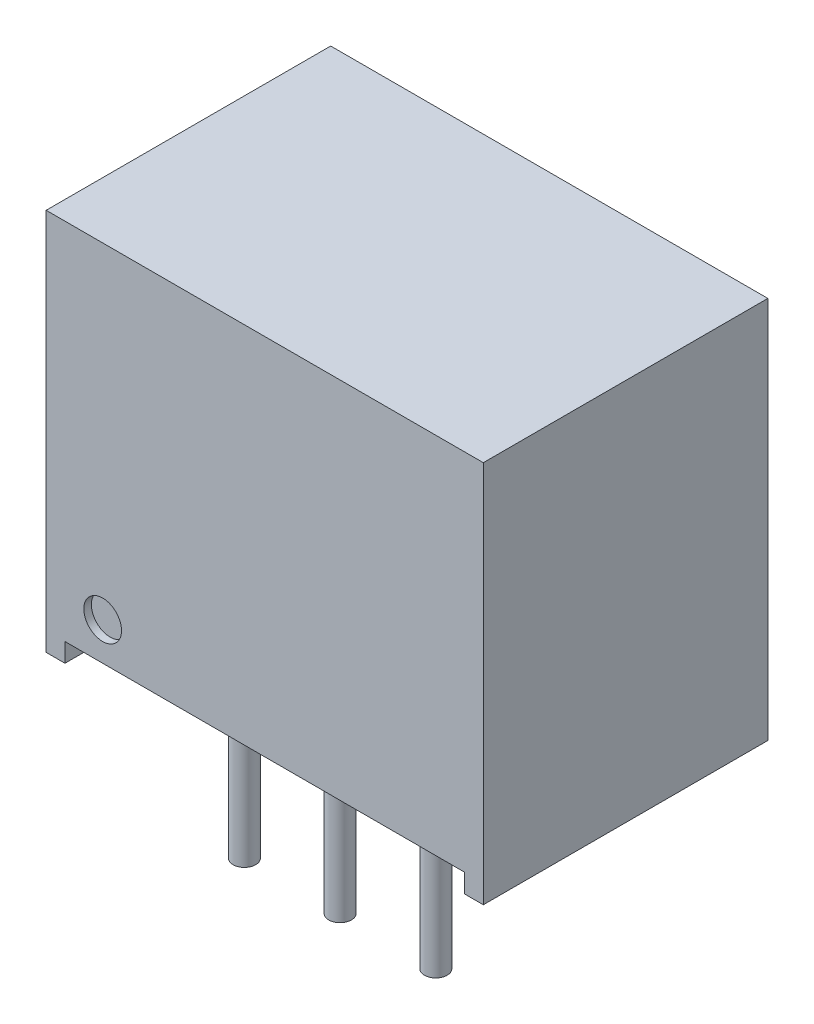
from build123d import *

# Parameters (mm, degrees)
SKETCH1_W                   = 11.6
SKETCH1_H                   = 7.55
BOSS_EXTRUDE1_DEPTH         = 10.16
SKETCH2_R                   = 0.5
CUT_EXTRUDE1_DEPTH          = 0.2
SKETCH3_R                   = 0.3
BOSS_EXTRUDE3_DEPTH         = 4.1
CUT_EXTRUDE_THIN1_START     = -0.5
CUT_EXTRUDE_THIN1_OUTLINE_W = 10.6
CUT_EXTRUDE_THIN1_OUTLINE_H = 7.55
CUT_EXTRUDE_THIN1_OUTLINE_R = 0.3
CUT_EXTRUDE_THIN1_DEPTH     = 0.5


# Read off the part's stored shape, not the designer's step: Cut-Extrude-Thin1
with BuildPart() as part:
    # Sketch1 → Boss-Extrude1 (new body)
    with BuildSketch(Plane(origin=(0, 0, 0), x_dir=(1, 0, 0), z_dir=(0, 1, 0))):
        with Locations((5.8, 3.775)):
            Rectangle(SKETCH1_W, SKETCH1_H)
    extrude(amount=BOSS_EXTRUDE1_DEPTH)

    # Sketch2 → Cut-Extrude1 (cut)
    with BuildSketch(Plane.XY):
        with Locations((1.5, 1.5)):
            Circle(SKETCH2_R)
    extrude(amount=-CUT_EXTRUDE1_DEPTH, mode=Mode.SUBTRACT)

    # Sketch3 → Boss-Extrude3 (add)
    with BuildSketch(Plane.XZ):
        with Locations(Location((5.8, -2, 0), (0, 0, 270))):
            Circle(SKETCH3_R)
        with Locations(Location((8.34, -2, 0), (0, 0, 270))):
            Circle(SKETCH3_R)
        with Locations(Location((3.26, -2, 0), (0, 0, 270))):
            Circle(SKETCH3_R)
    extrude(amount=BOSS_EXTRUDE3_DEPTH)

    # Cut-Extrude-Thin1 outline → Cut-Extrude-Thin1 (cut)
    with BuildSketch(Plane.XZ.offset(CUT_EXTRUDE_THIN1_START)):
        with Locations((5.8, -3.775)):
            Rectangle(CUT_EXTRUDE_THIN1_OUTLINE_W, CUT_EXTRUDE_THIN1_OUTLINE_H)
        with Locations((3.26, -2)):
            Circle(CUT_EXTRUDE_THIN1_OUTLINE_R, mode=Mode.SUBTRACT)
        with Locations((5.8, -2)):
            Circle(CUT_EXTRUDE_THIN1_OUTLINE_R, mode=Mode.SUBTRACT)
        with Locations((8.34, -2)):
            Circle(CUT_EXTRUDE_THIN1_OUTLINE_R, mode=Mode.SUBTRACT)
    extrude(amount=CUT_EXTRUDE_THIN1_DEPTH, mode=Mode.SUBTRACT)


solid = part.part
